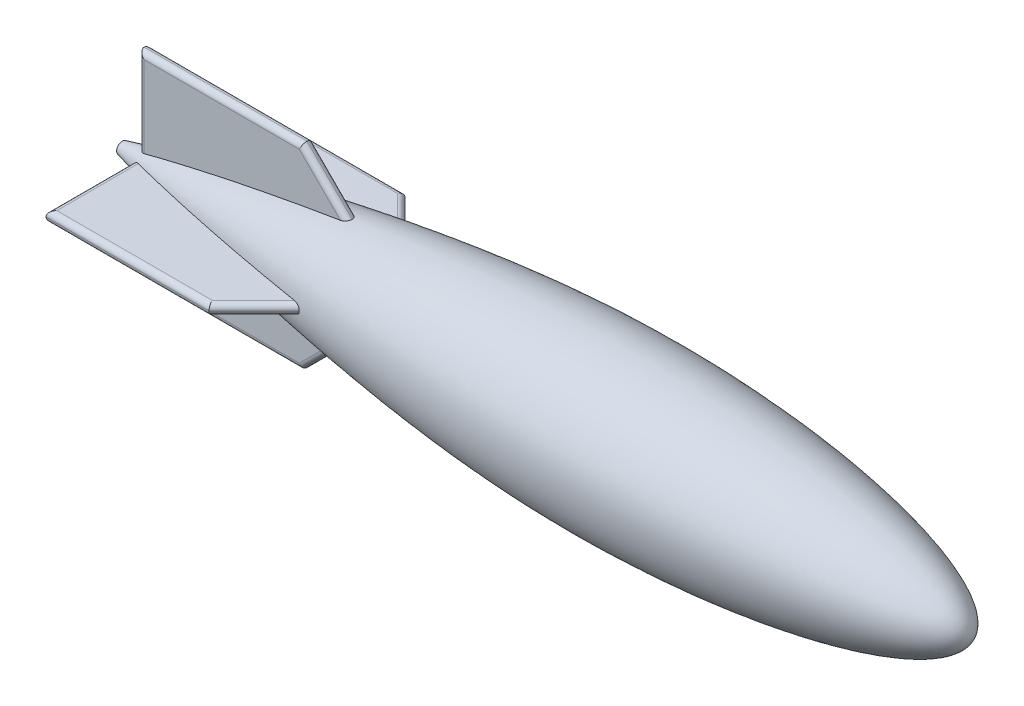
from build123d import *

# Parameters (mm, degrees)
CUT_EXTRUDE1_DEPTH      = 3.175
CUT_EXTRUDE1_DEPTH_BACK = 3.175
SKETCH3_R               = 6.509324081066561
BOSS_EXTRUDE5_DEPTH     = 0.79375
CIRPATTERN1_COUNT       = 4
FILLET2_R               = 0.79375


with BuildPart() as part:
    # Sketch2 → Revolve1 (revolve)
    with BuildSketch(Plane.XY):
        with BuildLine():
            Line((0, 0), (-127, -1.555e-14))
            add(Edge.make_bspline(
                [(-127, -1.555e-14), (-126.88600107696882, 0.01292807569490287), (-60.293650457458824, 18.501169159484686), (6.918e-14, 6.618926423252529), (0, 0)],
                knots=[0, 0, 0, 0, 0.5372544440165704, 1, 1, 1, 1], degree=3))
        make_face()
    revolve(axis=Axis((0, 0, 0), (-1, -1.2e-16, 0)))

    # Sketch3 → Cut-Extrude1 (cut, two sides: drawn at the far end of the back side and taken through both)
    with BuildSketch(Plane(origin=(-127, 0, 0), x_dir=(0, 0, -1), z_dir=(1, 0, 0)).offset(-CUT_EXTRUDE1_DEPTH_BACK)):
        Circle(SKETCH3_R)
    extrude(amount=CUT_EXTRUDE1_DEPTH + CUT_EXTRUDE1_DEPTH_BACK, mode=Mode.SUBTRACT)

    # Sketch4 → Boss-Extrude5 (add, symmetric)
    with BuildSketch(Plane.XY):
        Polygon((-120.64999999999937, 1.6175040904650868), (-120.65, 14.317504090465087), (-96.83750000000002, 14.317504090465087), (-90.2483075401766, 7.7283116306418425), (-89.68704153260985, 7.167045623074933), (-120.64999999999998, 0.8237540904650809), align=None)
    boss_extrude5 = extrude(amount=BOSS_EXTRUDE5_DEPTH, both=True)

    # CirPattern1: Boss-Extrude5 ×4 about axis
    cirpattern1_axis = Axis((0, -3.5e-16, 0), (1, 0, 0))
    for i in range(1, CIRPATTERN1_COUNT):
        add(boss_extrude5.rotate(cirpattern1_axis, i * 360 / CIRPATTERN1_COUNT))

    # Fillet2
    fillet2_edges = [part.edges().sort_by_distance(p)[0] for p in [
        (-93.52528303882053, 11.0052871292856, 0.79375),
        (-93.52528303882053, 11.005287129285604, -0.79375),
        (-108.74375, 14.317504090465087, -0.79375),
        (-108.74375, 14.317504090465087, 0.79375),
        (-120.64999999999999, 7.863429350843208, -0.79375),
        (-120.64999999999999, 7.863429350843208, 0.79375),
        (-120.64999999999999, 0.7937499999999978, -7.8634293508432105),
        (-120.64999999999999, -0.7937500000000021, -7.863429350843219),
        (-108.74375, 0.7937499999999964, -14.317504090465087),
        (-108.74375, -0.7937500000000035, -14.317504090465087),
        (-93.52528303882053, 0.7937499999999972, -11.005287129285605),
        (-93.52528303882053, -0.7937500000000027, -11.005287129285605),
        (-120.64999999999999, -7.863429350843224, -0.793749999999999),
        (-108.74375, -14.317504090465087, -0.7937499999999982),
        (-93.52528303882053, -11.005287129285612, -0.7937499999999986),
        (-120.64999999999999, -7.863429350843225, 0.793750000000001),
        (-93.52528303882053, -11.005287129285612, 0.7937500000000013),
        (-108.74375, -14.317504090465087, 0.7937500000000017),
        (-93.52528303882053, 0.7937500000000008, 11.005287129285605),
        (-93.52528303882053, -0.7937499999999991, 11.005287129285605),
        (-108.74375, -0.7937499999999987, 14.317504090465087),
        (-120.64999999999999, -0.7937499999999994, 7.8634293508432185),
        (-120.64999999999999, 0.7937500000000005, 7.863429350843211),
        (-108.74375, 0.7937500000000012, 14.317504090465087),
    ]]
    fillet(fillet2_edges, radius=FILLET2_R - 0.0001)  # a hair under: the kernel refuses the full size


solid = part.part
